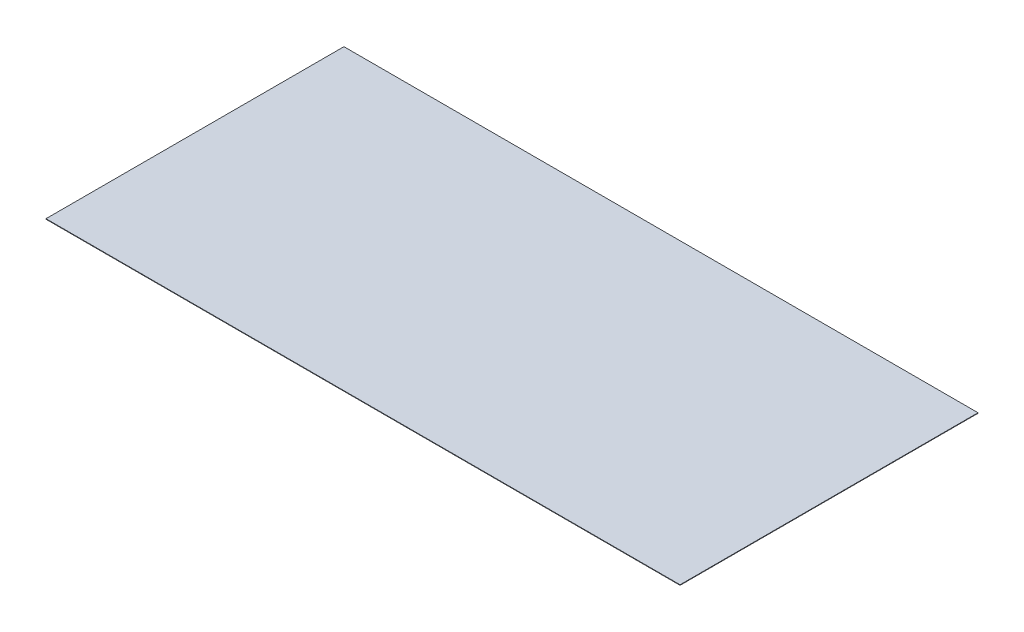
from build123d import *

# Parameters (mm, degrees)
SKETCH1_W           = 1262
SKETCH1_H           = 593
BOSS_EXTRUDE1_DEPTH = 1


with BuildPart() as part:
    # Sketch1 → Boss-Extrude1 (new body)
    with BuildSketch(Plane(origin=(0, 0, 0), x_dir=(1, 0, 0), z_dir=(0, 1, 0))):
        with Locations((-84.190544768, 151.114548674)):
            Rectangle(SKETCH1_W, SKETCH1_H)
    extrude(amount=BOSS_EXTRUDE1_DEPTH)


solid = part.part
